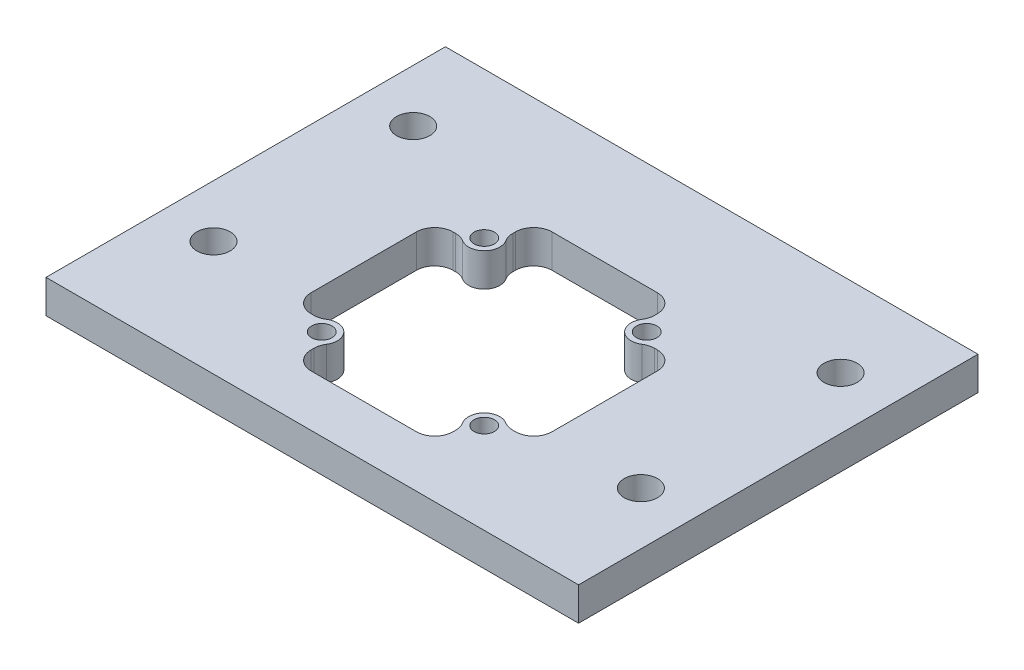
from build123d import *

# Parameters (mm, degrees)
SKETCH1_W                   = 101.6
SKETCH1_H                   = 76.2
BOSS_EXTRUDE1_DEPTH         = 3.175
F_1_4_0_25_DIAMETER_HOLE1_D = 6.35
M3_5_CLEARANCE_HOLE1_D      = 3.9
CUT_EXTRUDE6_DEPTH          = 64.816710194
CUT_EXTRUDE7_DEPTH          = 64.816710194
CIRPATTERN1_COUNT           = 4


with BuildPart() as part:
    # Sketch1 → Boss-Extrude1 (new, symmetric)
    with BuildSketch(Plane(origin=(0, 0, 0), x_dir=(1, 0, 0), z_dir=(0, 1, 0))):
        Rectangle(SKETCH1_W, SKETCH1_H)
    extrude(amount=BOSS_EXTRUDE1_DEPTH, both=True)

    # 1/4 (0.25) Diameter Hole1 (through all)
    with Locations(Plane(origin=(0, 3.175, 0), x_dir=(1, 0, 0), z_dir=(0, 1, 0))):
        with Locations((-40.767, 21.917741799), (-40.767, -16.182258201)):
            f_1_4_0_25_diameter_hole1 = Hole(F_1_4_0_25_DIAMETER_HOLE1_D / 2)

    # M3.5 Clearance Hole1 (through all)
    with Locations(Plane(origin=(0, 3.175, 0), x_dir=(1, 0, 0), z_dir=(0, 1, 0))):
        with Locations((-15.5, 10.2), (15.5, 10.2), (15.5, -20.8), (-15.5, -20.8)):
            Hole(M3_5_CLEARANCE_HOLE1_D / 2)

    # Sketch23 → Cut-Extrude6 (cut, through all)
    with BuildSketch(Plane(origin=(0, 3.175, 0), x_dir=(1, 0, 0), z_dir=(0, 1, 0))):
        with BuildLine():
            Line((-12.9860741, 15.72), (-12.9860741, 11.800180167))
            ThreePointArc((-12.9860741, 11.800180167), (-13.392821792, 8.092821792), (-17.100180167, 7.6860741))
            Line((-17.100180167, 7.6860741), (-21.02, 7.6860741))
            Line((-21.02, 7.6860741), (-21.02, -18.2860741))
            Line((-21.02, -18.2860741), (-17.100180167, -18.2860741))
            ThreePointArc((-17.100180167, -18.2860741), (-13.392821792, -18.692821792), (-12.9860741, -22.400180167))
            Line((-12.9860741, -22.400180167), (-12.9860741, -26.32))
            Line((-12.9860741, -26.32), (12.9860741, -26.32))
            Line((12.9860741, -26.32), (12.9860741, -22.400180167))
            ThreePointArc((12.9860741, -22.400180167), (13.392821792, -18.692821792), (17.100180167, -18.2860741))
            Line((17.100180167, -18.2860741), (21.02, -18.2860741))
            Line((21.02, -18.2860741), (21.02, 7.6860741))
            Line((21.02, 7.6860741), (17.100180167, 7.6860741))
            ThreePointArc((17.100180167, 7.6860741), (13.392821792, 8.092821792), (12.9860741, 11.800180167))
            Line((12.9860741, 11.800180167), (12.9860741, 15.72))
            Line((12.9860741, 15.72), (-12.9860741, 15.72))
        make_face()
    extrude(amount=-CUT_EXTRUDE6_DEPTH, mode=Mode.SUBTRACT)

    # Sketch24 → Cut-Extrude7 (cut, through all)
    with BuildSketch(Plane(origin=(0, 3.175, 0), x_dir=(1, 0, 0), z_dir=(0, 1, 0))):
        with BuildLine():
            Line((-18.979586404, 8.233476566), (-19.479586404, 8.233476566))
            ThreePointArc((-19.479586404, 8.233476566), (-21.954460139, 7.2083503), (-22.979586404, 4.733476566))
            Line((-22.979586404, 4.733476566), (-22.979586404, -15.333476566))
            ThreePointArc((-22.979586404, -15.333476566), (-21.954460139, -17.8083503), (-19.479586404, -18.833476566))
            Line((-19.479586404, -18.833476566), (-18.979586404, -18.833476566))
            ThreePointArc((-18.979586404, -18.833476566), (-18.000834998, -18.693840487), (-17.100180167, -18.2860741))
            ThreePointArc((-17.100180167, -18.2860741), (-13.392821792, -18.692821792), (-12.9860741, -22.400180167))
            Line((-12.9860741, -22.400180167), (-7.9860741, -22.400180167))
            Line((-7.9860741, -22.400180167), (-7.9860741, 11.800180167))
            Line((-7.9860741, 11.800180167), (-12.9860741, 11.800180167))
            ThreePointArc((-12.9860741, 11.800180167), (-13.392821792, 8.092821792), (-17.100180167, 7.6860741))
            ThreePointArc((-17.100180167, 7.6860741), (-18.000834998, 8.093840487), (-18.979586404, 8.233476566))
        make_face()
    cut_extrude7 = extrude(amount=-CUT_EXTRUDE7_DEPTH, mode=Mode.SUBTRACT)

    # CirPattern1: Cut-Extrude7 ×4 about axis
    cirpattern1_axis = Axis((0, 3.175, 5.3), (0, 1, 0))
    for i in range(1, CIRPATTERN1_COUNT):
        add(cut_extrude7.rotate(cirpattern1_axis, i * 360 / CIRPATTERN1_COUNT), mode=Mode.SUBTRACT)

    # Mirror2: 1/4 (0.25) Diameter Hole1 across plane
    add(f_1_4_0_25_diameter_hole1.mirror(Plane(origin=(0, 0, 0), x_dir=(0, 0, 1), z_dir=(1, 0, 0))), mode=Mode.SUBTRACT)


solid = part.part
